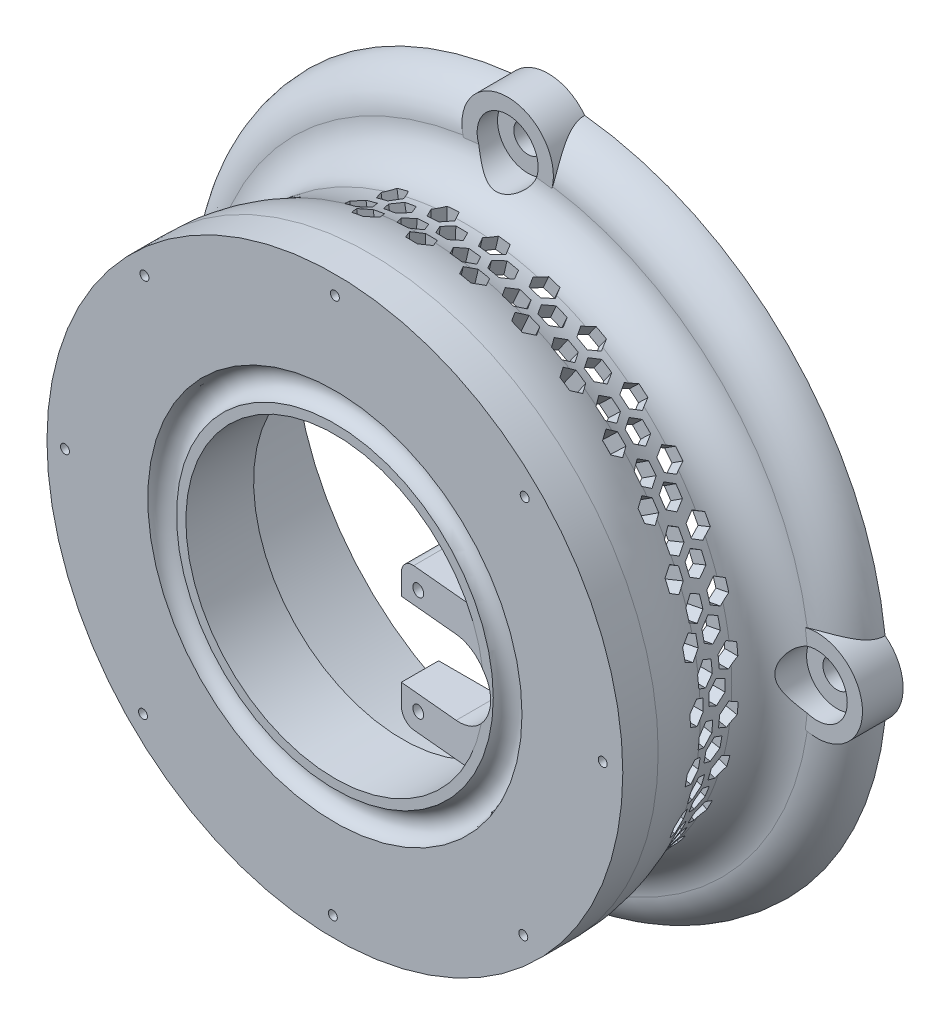
from build123d import *

# Parameters (mm, degrees)
SZKIC2_R                                     = 85
SZKIC2_R_2                                   = 44
DODANIE_WYCI_GNI_CIE1_DEPTH                  = 20
WYTNIJ_WYCI_GNI_CIE1_START                   = -6.55
WYTNIJ_WYCI_GNI_CIE1_DEPTH                   = 6.55
DODANIE_WYCI_GNI_CIE2_DEPTH                  = 21
DODANIE_WYCI_GNI_CIE2_DEPTH_BACK             = 21
ZAOKR_GLENIE2_R                              = 4
SZKIC11_R                                    = 1.75
WYTNIJ_WYCI_GNI_CIE3_DEPTH                   = 126.361655779
WYTNIJ_WYCI_GNI_CIE5_DEPTH                   = 125.484726928
SZKIC15_R                                    = 1.325
WYTNIJ_WYCI_GNI_CIE6_DEPTH                   = 10
WYTNIJ_WYCI_GNI_CIE14_DEPTH                  = 159.871988647
SZYK_KO_OWY1_COUNT                           = 10
SZYK_KO_OWY1_ANGLE                           = 99
SZYK_KO_OWY2_COUNT                           = 10
SZYK_KO_OWY2_ANGLE                           = 99
SZKIC25_3_R                                  = 13.5
DODANIE_WYCI_GNI_CIE3_DEPTH                  = 12
POG_BIENIE_WALCOWE_POD_M8_WKR_T_DO_C_2_COUNT = 2
POG_BIENIE_WALCOWE_POD_M8_WKR_T_DO_C_2_PITCH = 129.046987567
POG_BIENIE_WALCOWE_POD_M8_WKR_T_DO_C_3_COUNT = 2
POG_BIENIE_WALCOWE_POD_M8_WKR_T_DO_C_3_PITCH = 129.046987567
POG_BIENIE_WALCOWE_POD_M8_WKR_T_DO_C_4_COUNT = 2
POG_BIENIE_WALCOWE_POD_M8_WKR_T_DO_C_4_PITCH = 182.5
WYTNIJ_WYCI_GNI_CIE16_REACH                  = 164.04
SZKIC28_R                                    = 9
ZAOKR_GLENIE9_R                              = 40


with BuildPart() as part:
    # Szkic2 → Dodanie-wyciągnięcie1 (new body)
    with BuildSketch(Plane.XY.offset(-2)):
        with Locations((3.982864722, 1.009269975)):
            Circle(SZKIC2_R)
        with Locations((3.982864722, 1.009269975)):
            Circle(SZKIC2_R_2, mode=Mode.SUBTRACT)
    extrude(amount=-DODANIE_WYCI_GNI_CIE1_DEPTH)

    # Szkic4 → Wycięcie-obrót3 (revolve, cut)
    with BuildSketch(Plane(origin=(3.982864722, 0, -274.858046523), x_dir=(0, 0, -1), z_dir=(1, 0, 0)), mode=Mode.PRIVATE) as wyci_cie_obr_t3_sk:
        with BuildLine():
            Line((-272.858046523, 56.248668517), (-272.858046523, 47.769871432))
            ThreePointArc((-272.858046523, 47.769871432), (-268.908046523, 52.009269975), (-272.858046523, 56.248668517))
        make_face()
    revolve(wyci_cie_obr_t3_sk.sketch.rotate(Axis((3.982864722, 1.009269975, -22), (0, 0, -1)), 90), axis=Axis((3.982864722, 1.009269975, -22), (0, 0, -1)), mode=Mode.SUBTRACT)

    # Szkic7 → Wytnij-wyciągnięcie1 (cut)
    with BuildSketch(Plane(origin=(0, 0, -22), x_dir=(-1, 0, 0), z_dir=(0, 0, -1)).offset(WYTNIJ_WYCI_GNI_CIE1_START)):
        Polygon((-25, 21.5), (-58.093048471, 21.5), (-63.155548471, 17), (-63.155548471, -17), (-59.155548471, -21.5), (-25, -21.5), align=None)
    extrude(amount=WYTNIJ_WYCI_GNI_CIE1_DEPTH, mode=Mode.SUBTRACT)

    # Szkic8 → Dodanie-wyciągnięcie2 (add, two sides: drawn at the far end of the back side and taken through both)
    with BuildSketch(Plane(origin=(0, 0, 0), x_dir=(1, 0, 0), z_dir=(0, 1, 0)).offset(-DODANIE_WYCI_GNI_CIE2_DEPTH_BACK)):
        Polygon((21.155548471, 15.45), (21.155548471, 4.45), (47.971287905, 2), (47.971287905, 15.45), align=None)
    extrude(amount=DODANIE_WYCI_GNI_CIE2_DEPTH + DODANIE_WYCI_GNI_CIE2_DEPTH_BACK)

    # Szkic4<2> → Wycięcie-obrót4 (revolve, cut)
    with BuildSketch(Plane(origin=(3.982864722, 0, -274.858046523), x_dir=(0, 0, -1), z_dir=(1, 0, 0))):
        with BuildLine():
            Line((-272.858046523, 56.248668517), (-272.858046523, 47.769871432))
            ThreePointArc((-272.858046523, 47.769871432), (-268.908046523, 52.009269975), (-272.858046523, 56.248668517))
        make_face()
    revolve(axis=Axis((3.982864722, 1.009269975, -22), (0, 0, -1)), mode=Mode.SUBTRACT)

    # Zaokrąglenie2
    zaokr_glenie2_edges = [part.edges().sort_by_distance(p)[0] for p in [
        (21.155548471, 21, -9.95),
        (21.155548471, -21, -9.95),
    ]]
    fillet(zaokr_glenie2_edges, radius=ZAOKR_GLENIE2_R)

    # Szkic11 → Wytnij-wyciągnięcie3 (cut, through all)
    with BuildSketch(Plane(origin=(0, 0, -22), x_dir=(-1, 0, 0), z_dir=(0, 0, -1))):
        with Locations((-26.655548471, 15.5)):
            Circle(SZKIC11_R)
        with Locations((-26.655548471, -15.5)):
            Circle(SZKIC11_R)
    extrude(amount=-WYTNIJ_WYCI_GNI_CIE3_DEPTH, mode=Mode.SUBTRACT)

    # Szkic12 → Wytnij-wyciągnięcie5 (cut, through all)
    with BuildSketch(Plane(origin=(0, 0, -15.45), x_dir=(-1, 0, 0), z_dir=(0, 0, -1))):
        with BuildLine():
            Line((-21.155548471, 11), (-38.971287905, 11))
            ThreePointArc((-38.971287905, 11), (-49.971287905, 0), (-38.971287905, -11))
            Line((-38.971287905, -11), (-21.155548471, -11))
            Line((-21.155548471, -11), (-21.155548471, 11))
        make_face()
    extrude(amount=-WYTNIJ_WYCI_GNI_CIE5_DEPTH, mode=Mode.SUBTRACT)

    # Szkic14 → Obrót2 (revolve)
    with BuildSketch(Plane(origin=(3.982864722, 0, 0), x_dir=(0, -1, 0), z_dir=(1, 0, 0)), mode=Mode.PRIVATE) as obr_t2_sk:
        with BuildLine():
            Line((-86.009269975, 65), (-101.009269975, 65))
            ThreePointArc((-101.009269975, 65), (-97.965707137, 57.013622012), (-90.378897748, 53.0784179))
            ThreePointArc((-90.378897748, 53.0784179), (-82.539678636, 48.810614703), (-79.868505534, 40.294022975))
            ThreePointArc((-79.868505534, 40.294022975), (-81.819160282, 30.77115197), (-86.009269975, 22))
            Line((-86.009269975, 22), (-76.009269975, 22))
            Line((-76.009269975, 22), (-76.009269975, 65))
            Line((-76.009269975, 65), (-86.009269975, 65))
        make_face()
    revolve(obr_t2_sk.sketch.rotate(Axis((3.982864722, 1.009269975, -22), (0, 0, -1)), 90), axis=Axis((3.982864722, 1.009269975, -22), (0, 0, -1)))

    # Szkic15 → Wytnij-wyciągnięcie6 (cut)
    with BuildSketch(Plane.XY.offset(-2)):
        with Locations((3.982864722, 80.509269975)):
            Circle(SZKIC15_R)
        with Locations((60.021077131, 57.047482384)):
            Circle(SZKIC15_R)
        with Locations((83.056088026, 0.832493279)):
            Circle(SZKIC15_R)
        with Locations((59.594300435, -55.20571913)):
            Circle(SZKIC15_R)
        with Locations((3.379311331, -78.240730025)):
            Circle(SZKIC15_R)
        with Locations((-52.658901078, -54.778942434)):
            Circle(SZKIC15_R)
        with Locations((-75.693911974, 1.43604667)):
            Circle(SZKIC15_R)
        with Locations((-52.232124383, 57.474259079)):
            Circle(SZKIC15_R)
    extrude(amount=-WYTNIJ_WYCI_GNI_CIE6_DEPTH, mode=Mode.SUBTRACT)

    # Szkic22 → Wytnij-wyciągnięcie14 (cut, through all)
    with BuildSketch(Plane(origin=(0, 0, 0), x_dir=(0, 0, -1), z_dir=(1, 0, 0))):
        Polygon((32.059059482, 4.119844564), (32.059059482, 0.655742949), (35.059059482, -1.076307859), (38.059059482, 0.655742949), (38.059059482, 4.119844564), (35.059059482, 5.851895371), align=None)
        Polygon((36.355405095, 10.926885891), (36.355405095, 7.462784276), (39.355405095, 5.730733468), (42.355405095, 7.462784276), (42.355405095, 10.926885891), (39.355405095, 12.658936698), align=None)
        Polygon((27.762713869, 11.312803237), (27.762713869, 7.848701621), (30.762713869, 6.116650814), (33.762713869, 7.848701621), (33.762713869, 11.312803237), (30.762713869, 13.044854044), align=None)
        Polygon((23.466368256, 4.505761909), (23.466368256, 1.041660294), (26.466368256, -0.690390513), (29.466368256, 1.041660294), (29.466368256, 4.505761909), (26.466368256, 6.237812717), align=None)
    wytnij_wyci_gni_cie14 = extrude(amount=WYTNIJ_WYCI_GNI_CIE14_DEPTH, mode=Mode.SUBTRACT)

    # Szyk kołowy1: Wytnij-wyciągnięcie14 ×10 about axis
    szyk_ko_owy1_axis = Axis((3.982864722, 1.009269975, 0), (0, 0, 1))
    for i in range(1, SZYK_KO_OWY1_COUNT):
        add(wytnij_wyci_gni_cie14.rotate(szyk_ko_owy1_axis, i * SZYK_KO_OWY1_ANGLE / (SZYK_KO_OWY1_COUNT - 1)), mode=Mode.SUBTRACT)

    # Szyk kołowy2: Wytnij-wyciągnięcie14 ×10 about axis
    szyk_ko_owy2_axis = Axis((3.982864722, 1.009269975, 0), (0, 0, -1))
    for i in range(1, SZYK_KO_OWY2_COUNT):
        add(wytnij_wyci_gni_cie14.rotate(szyk_ko_owy2_axis, i * SZYK_KO_OWY2_ANGLE / (SZYK_KO_OWY2_COUNT - 1)), mode=Mode.SUBTRACT)

    # Szkic25<3> → Dodanie-wyciągnięcie3 (add)
    with BuildSketch(Plane(origin=(0, 0, -65), x_dir=(-1, 0, 0), z_dir=(0, 0, -1))):
        with Locations((-3.982864722, -90.240730025)):
            Circle(SZKIC25_3_R)
        with Locations((-95.232864722, 1.009269975)):
            Circle(SZKIC25_3_R)
        with Locations((-3.982864722, 92.259269975)):
            Circle(SZKIC25_3_R)
        with Locations((87.267135278, 1.009269975)):
            Circle(SZKIC25_3_R)
    extrude(amount=-DODANIE_WYCI_GNI_CIE3_DEPTH)

    # Szkic27 → Pogłębienie walcowe pod M8 wkręt do części metalowych z łbem stożkowym ściętym1 (revolve, cut)
    with BuildSketch(Plane(origin=(3.982864722, -90.240730025, -53), x_dir=(0, -1, 0), z_dir=(1, 0, 0))):
        Polygon((0, 0), (0, 12), (4.2, 12), (4.2, 6), (9, 6), (9, 0), align=None)
    pog_bienie_walcowe_pod_m8_wkr_t_do_cz_ci = revolve(axis=Axis((3.982864722, -90.240730025, -46.65), (0, 0, -1)), mode=Mode.SUBTRACT)

    # Pog_bienie walcowe pod M8 wkr_t do c 2: Pogłębienie walcowe pod M8 wkręt do części metalowych z łbem stożkowym ściętym1 ×2
    with Locations(*[Vector(0.7071067811865475, 0.7071067811865477, 0) * (i * POG_BIENIE_WALCOWE_POD_M8_WKR_T_DO_C_2_PITCH) for i in range(1, POG_BIENIE_WALCOWE_POD_M8_WKR_T_DO_C_2_COUNT)]):
        add(pog_bienie_walcowe_pod_m8_wkr_t_do_cz_ci, mode=Mode.SUBTRACT)

    # Pog_bienie walcowe pod M8 wkr_t do c 3: Pogłębienie walcowe pod M8 wkręt do części metalowych z łbem stożkowym ściętym1 ×2
    with Locations(*[Vector(-0.7071067811865476, 0.7071067811865475, 0) * (i * POG_BIENIE_WALCOWE_POD_M8_WKR_T_DO_C_3_PITCH) for i in range(1, POG_BIENIE_WALCOWE_POD_M8_WKR_T_DO_C_3_COUNT)]):
        add(pog_bienie_walcowe_pod_m8_wkr_t_do_cz_ci, mode=Mode.SUBTRACT)

    # Pog_bienie walcowe pod M8 wkr_t do c 4: Pogłębienie walcowe pod M8 wkręt do części metalowych z łbem stożkowym ściętym1 ×2
    with Locations(*[(0, i * POG_BIENIE_WALCOWE_POD_M8_WKR_T_DO_C_4_PITCH, 0) for i in range(1, POG_BIENIE_WALCOWE_POD_M8_WKR_T_DO_C_4_COUNT)]):
        add(pog_bienie_walcowe_pod_m8_wkr_t_do_cz_ci, mode=Mode.SUBTRACT)

    # Szkic28 → Wytnij-wyciągnięcie16 (cut, up to next)
    with BuildSketch(Plane.XY.offset(-59), mode=Mode.PRIVATE) as wytnij_wyci_gni_cie16_sk1:
        with Locations((-87.267135278, 1.009269975)):
            Circle(SZKIC28_R)
    wytnij_wyci_gni_cie16_tool1 = extrude(wytnij_wyci_gni_cie16_sk1.sketch, amount=WYTNIJ_WYCI_GNI_CIE16_REACH, mode=Mode.PRIVATE) & part.part
    # Szkic28 → Wytnij-wyciągnięcie16 (cut, up to next)
    with BuildSketch(Plane.XY.offset(-59), mode=Mode.PRIVATE) as wytnij_wyci_gni_cie16_sk2:
        with Locations((3.982864722, -90.240730025)):
            Circle(SZKIC28_R)
    wytnij_wyci_gni_cie16_tool2 = extrude(wytnij_wyci_gni_cie16_sk2.sketch, amount=WYTNIJ_WYCI_GNI_CIE16_REACH, mode=Mode.PRIVATE) & part.part
    # Szkic28 → Wytnij-wyciągnięcie16 (cut, up to next)
    with BuildSketch(Plane.XY.offset(-59), mode=Mode.PRIVATE) as wytnij_wyci_gni_cie16_sk3:
        with Locations((3.982864722, 92.259269975)):
            Circle(SZKIC28_R)
    wytnij_wyci_gni_cie16_tool3 = extrude(wytnij_wyci_gni_cie16_sk3.sketch, amount=WYTNIJ_WYCI_GNI_CIE16_REACH, mode=Mode.PRIVATE) & part.part
    # Szkic28 → Wytnij-wyciągnięcie16 (cut, up to next)
    with BuildSketch(Plane.XY.offset(-59), mode=Mode.PRIVATE) as wytnij_wyci_gni_cie16_sk4:
        with Locations((95.232864722, 1.009269975)):
            Circle(SZKIC28_R)
    wytnij_wyci_gni_cie16_tool4 = extrude(wytnij_wyci_gni_cie16_sk4.sketch, amount=WYTNIJ_WYCI_GNI_CIE16_REACH, mode=Mode.PRIVATE) & part.part
    add(wytnij_wyci_gni_cie16_tool1.solids().sort_by_distance((-87.267135, 1.00927, -59))[0], mode=Mode.SUBTRACT)
    add(wytnij_wyci_gni_cie16_tool2.solids().sort_by_distance((3.982865, -90.24073, -59))[0], mode=Mode.SUBTRACT)
    add(wytnij_wyci_gni_cie16_tool3.solids().sort_by_distance((3.982865, 92.25927, -59))[0], mode=Mode.SUBTRACT)
    add(wytnij_wyci_gni_cie16_tool4.solids().sort_by_distance((95.232865, 1.00927, -59))[0], mode=Mode.SUBTRACT)

    # Zaokrąglenie9
    # the kernel refuses this fillet: 40 mm, written as the material it takes off along each edge
    with BuildSketch(Plane(origin=(3.982864722, 1.009269975, -22), x_dir=(1, 0, 0), z_dir=(0, -1, 0))) as zaokr_glenie9_piece_1:
        with BuildLine():
            CenterArc((45, 9.545225139), ZAOKR_GLENIE9_R, 337.165828949, 22.834171051)
            ThreePointArc((81.865274976, -5.977387431), (83.306336277, -2.922457493), (85, 0))
            Line((85, 0), (85, 9.545225139))
        make_face()
    revolve(axis=Axis((3.982864722, 1.009269975, -22), (0, 0, 1)), mode=Mode.SUBTRACT)


solid = part.part
